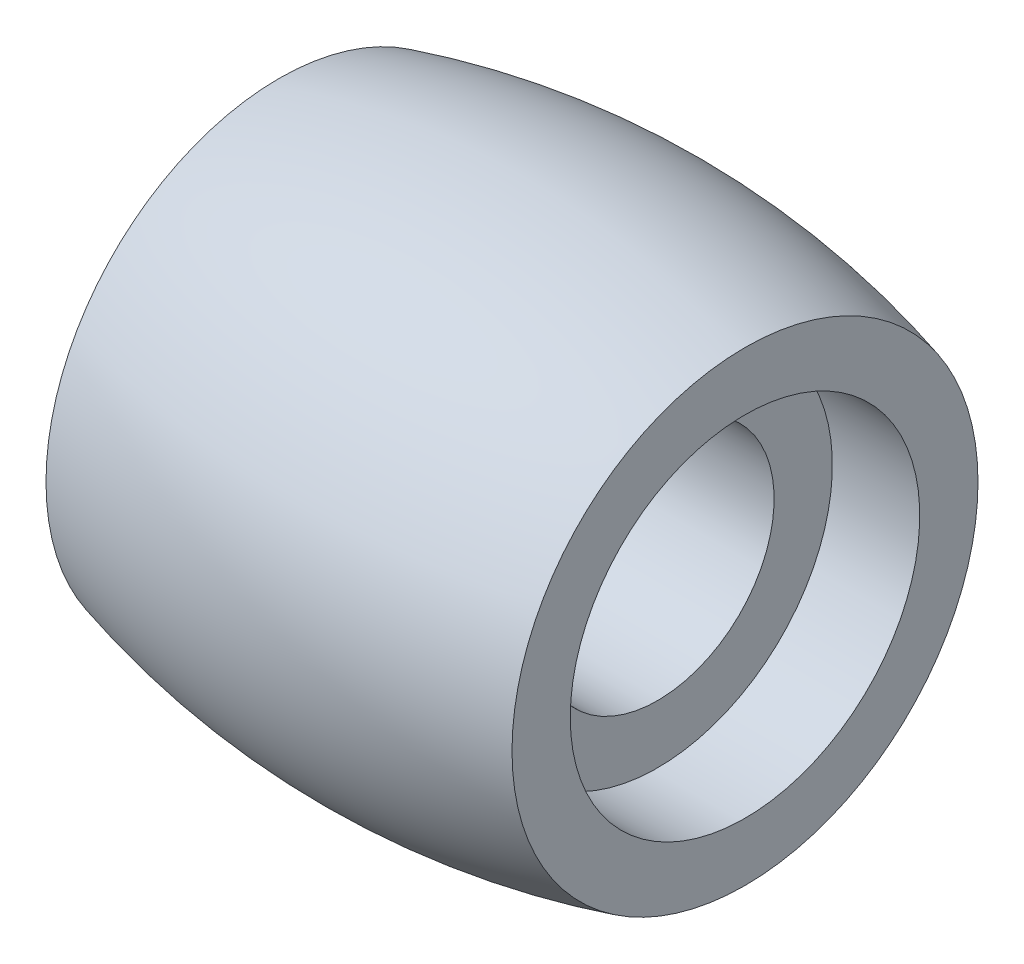
from build123d import *


with BuildPart() as part:
    # Sketch2 → Revolve1 (revolve)
    with BuildSketch(Plane.XY):
        with BuildLine():
            Line((-2.5, 2), (2.5, 2))
            Line((2.5, 2), (2.5, 3))
            Line((2.5, 3), (4, 3))
            Line((4, 3), (4, 4))
            ThreePointArc((4, 4), (0, 4.543167705), (-4, 4))
            Line((-4, 4), (-4, 3))
            Line((-4, 3), (-2.5, 3))
            Line((-2.5, 3), (-2.5, 2))
        make_face()
    revolve(axis=Axis((-8.91796875, 0, 0), (1, 0, 0)))


solid = part.part
